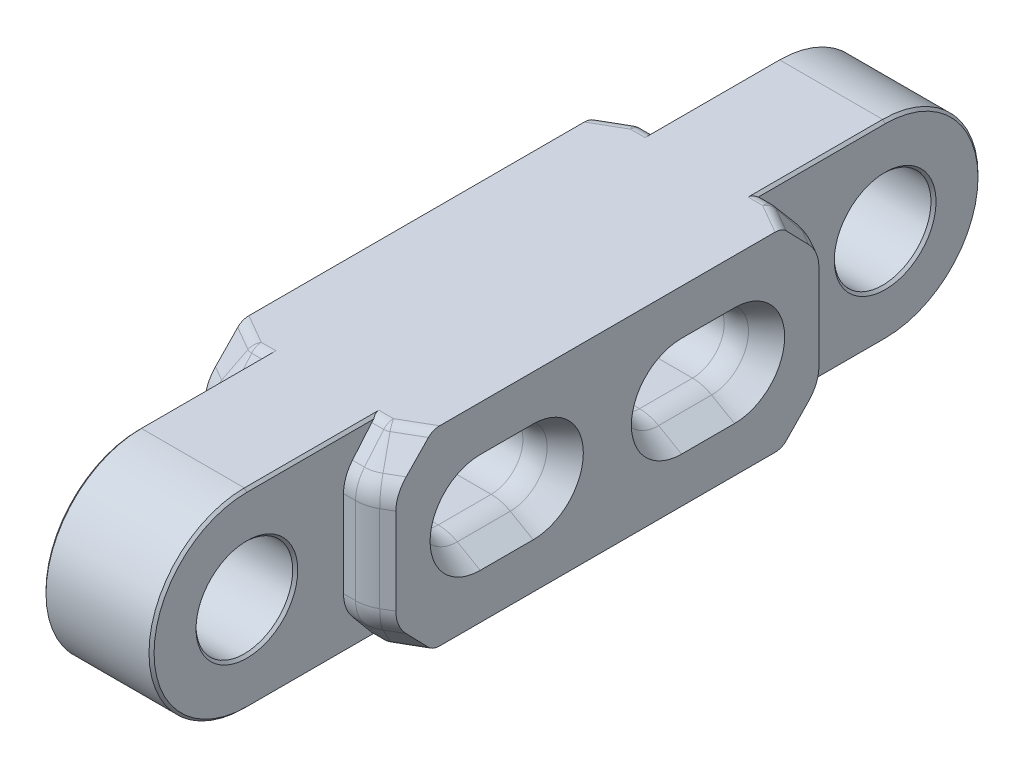
from build123d import *
from OCP.BRepFilletAPI import BRepFilletAPI_MakeChamfer

# Parameters (mm, degrees)
BOSS_EXTRUDE1_DEPTH = 8.5
BOSS_EXTRUDE2_DEPTH = 15
CHAMFER8_SIZE       = 3
CHAMFER8_SIZE2      = 1.732050808
FILLET6_R           = 6
CHAMFER9_SIZE       = 6
CHAMFER9_SIZE2      = 5.034597787
FILLET7_R           = 6
CHAMFER10_SIZE      = 5
CHAMFER10_SIZE2     = 2.886751346
FILLET8_R           = 6
FILLET9_R           = 2
CHAMFER11_SIZE      = 0.4


with BuildPart() as part:
    # Sketch1 → Boss-Extrude1 (new body)
    with BuildSketch(Plane.YZ):
        with BuildLine():
            ThreePointArc((0, -7.6), (-7.6, 0), (0, 7.6))
            Line((0, 7.6), (0, 15))
            ThreePointArc((0, 15), (-10.606601718, 10.606601718), (-15, 0))
            Line((-15, 0), (-15, -50.2))
            Line((-15, -50.2), (0, -50.2))
            Line((0, -50.2), (0, -43.533333333))
            ThreePointArc((0, -43.533333333), (-3.535533906, -42.068867239), (-5, -38.533333333))
            Line((-5, -38.533333333), (-5, -30.2))
            ThreePointArc((-5, -30.2), (-3.535533906, -26.664466094), (0, -25.2))
            Line((0, -25.2), (0, -7.6))
        make_face()
    extrude(amount=BOSS_EXTRUDE1_DEPTH)

    # Sketch1<4> → Boss-Extrude2 (add)
    with BuildSketch(Plane.YZ):
        with BuildLine():
            Line((0, -15.2), (-15, -15.2))
            Line((-15, -15.2), (-15, -50.2))
            Line((-15, -50.2), (0, -50.2))
            Line((0, -50.2), (0, -43.533333333))
            ThreePointArc((0, -43.533333333), (-3.535533906, -42.068867239), (-5, -38.533333333))
            Line((-5, -38.533333333), (-5, -30.2))
            ThreePointArc((-5, -30.2), (-3.535533906, -26.664466094), (0, -25.2))
            Line((0, -25.2), (0, -15.2))
        make_face()
    extrude(amount=BOSS_EXTRUDE2_DEPTH)

    # Chamfer8
    chamfer8_edges = [part.edges().sort_by_distance(p)[0] for p in [
        (15, -7.5, -15.2),
    ]]
    chamfer8_side = [part.faces().sort_by_distance(p)[0] for p in [
        (11.75, -7.5, -15.2),
    ]]
    chamfer(chamfer8_edges, length=CHAMFER8_SIZE, length2=CHAMFER8_SIZE2, reference=chamfer8_side[0])

    # Fillet6
    fillet6_edges = [part.edges().sort_by_distance(p)[0] for p in [
        (12, -7.5, -15.2),
    ]]
    fillet(fillet6_edges, radius=FILLET6_R)

    # Chamfer9: one chamfer whose edges measure the first distance from different faces: ONE call of the kernel's chamfer builder (chamfer() names one face for all edges)
    chamfer9_edges_1 = [part.edges().sort_by_distance(p)[0] for p in [
        (14.196152423, -15, -16.467949192),
    ]]
    chamfer9_side_1 = [part.faces().sort_by_distance(p)[0] for p in [
        (14.196152423, -7.5, -16.467949192),
    ]]
    chamfer9_edges_2 = [part.edges().sort_by_distance(p)[0] for p in [
        (11.945219116, -15, -15.404445042),
    ]]
    chamfer9_side_2 = [part.faces().sort_by_distance(p)[0] for p in [
        (11.945219116, -7.5, -15.404445042),
    ]]
    chamfer9_edges_3 = [part.edges().sort_by_distance(p)[0] for p in [
        (9.446152423, -15, -15.2),
    ]]
    chamfer9_side_3 = [part.faces().sort_by_distance(p)[0] for p in [
        (9.446152423, -7.5, -15.2),
    ]]
    chamfer9 = BRepFilletAPI_MakeChamfer(part.part.solid().wrapped)
    for e in chamfer9_edges_1:
        chamfer9.Add(CHAMFER9_SIZE, CHAMFER9_SIZE2, e.wrapped, chamfer9_side_1[0].wrapped)  # the first distance lies on this face
    for e in chamfer9_edges_2:
        chamfer9.Add(CHAMFER9_SIZE, CHAMFER9_SIZE2, e.wrapped, chamfer9_side_2[0].wrapped)  # the first distance lies on this face
    for e in chamfer9_edges_3:
        chamfer9.Add(CHAMFER9_SIZE, CHAMFER9_SIZE2, e.wrapped, chamfer9_side_3[0].wrapped)  # the first distance lies on this face
    add(Compound.cast(chamfer9.Shape()), mode=Mode.REPLACE)

    # Fillet7
    fillet7_edges = [part.edges().sort_by_distance(p)[0] for p in [
        (14.196152423, -9, -16.467949192),
        (11.945219116, -9, -15.404445042),
        (9.446152423, -9, -15.2),
    ]]
    fillet(fillet7_edges, radius=FILLET7_R)

    # Chamfer10: one chamfer whose edges measure the first distance from different faces: ONE call of the kernel's chamfer builder (chamfer() names one face for all edges)
    chamfer10_edges_1 = [part.edges().sort_by_distance(p)[0] for p in [
        (15, -3.535533906, -42.068867239),
    ]]
    chamfer10_side_1 = [part.faces().sort_by_distance(p)[0] for p in [
        (7.5, -3.535533906, -42.068867239),
    ]]
    chamfer10_edges_2 = [part.edges().sort_by_distance(p)[0] for p in [
        (15, -5, -34.366666667),
    ]]
    chamfer10_side_2 = [part.faces().sort_by_distance(p)[0] for p in [
        (7.5, -5, -34.366666667),
    ]]
    chamfer10_edges_3 = [part.edges().sort_by_distance(p)[0] for p in [
        (15, -3.535533906, -26.664466094),
    ]]
    chamfer10_side_3 = [part.faces().sort_by_distance(p)[0] for p in [
        (7.5, -3.535533906, -26.664466094),
    ]]
    chamfer10 = BRepFilletAPI_MakeChamfer(part.part.solid().wrapped)
    for e in chamfer10_edges_1:
        chamfer10.Add(CHAMFER10_SIZE, CHAMFER10_SIZE2, e.wrapped, chamfer10_side_1[0].wrapped)  # the first distance lies on this face
    for e in chamfer10_edges_2:
        chamfer10.Add(CHAMFER10_SIZE, CHAMFER10_SIZE2, e.wrapped, chamfer10_side_2[0].wrapped)  # the first distance lies on this face
    for e in chamfer10_edges_3:
        chamfer10.Add(CHAMFER10_SIZE, CHAMFER10_SIZE2, e.wrapped, chamfer10_side_3[0].wrapped)  # the first distance lies on this face
    add(Compound.cast(chamfer10.Shape()), mode=Mode.REPLACE)

    # Fillet8
    fillet8_edges = [part.edges().sort_by_distance(p)[0] for p in [
        (10, -3.535533906, -42.068867239),
        (10, -5, -34.366666667),
        (10, -3.535533906, -26.664466094),
    ]]
    fillet(fillet8_edges, radius=FILLET8_R)

    # Fillet9
    fillet9_edges = [part.edges().sort_by_distance(p)[0] for p in [
        (9.446152423, -15, -20.234597787),
        (10.642169324, -15, -20.26749307),
        (12.937502976, -15, -21.554720371),
    ]]
    fillet(fillet9_edges, radius=FILLET9_R)

    # Chamfer11
    chamfer11_edges = [part.edges().sort_by_distance(p)[0] for p in [
        (8.5, -7.6, 0),
        (8.5, -15, -10.583606552),
        (8.5, -10.606601718, 10.606601718),
    ]]
    chamfer(chamfer11_edges, length=CHAMFER11_SIZE)

    # Mirror1: part across plane


with BuildPart() as part_1:
    add(part.part)
    add(part.part.mirror(Plane(origin=(8.5, 0, 0), x_dir=(0, 0, 1), z_dir=(0, 1, 0))))

    # Mirror2: part across plane


with BuildPart() as part_2:
    add(part_1.part)
    add(part_1.part.mirror(Plane(origin=(8.5, 0, -50.2), x_dir=(1, 0, 0), z_dir=(0, 0, 1))))

    # Mirror3: part across plane


with BuildPart() as part_3:
    add(part_2.part)
    add(part_2.part.mirror(Plane(origin=(0, 0, 0), x_dir=(0, 0, 1), z_dir=(1, 0, 0))))


solid = part_3.part
